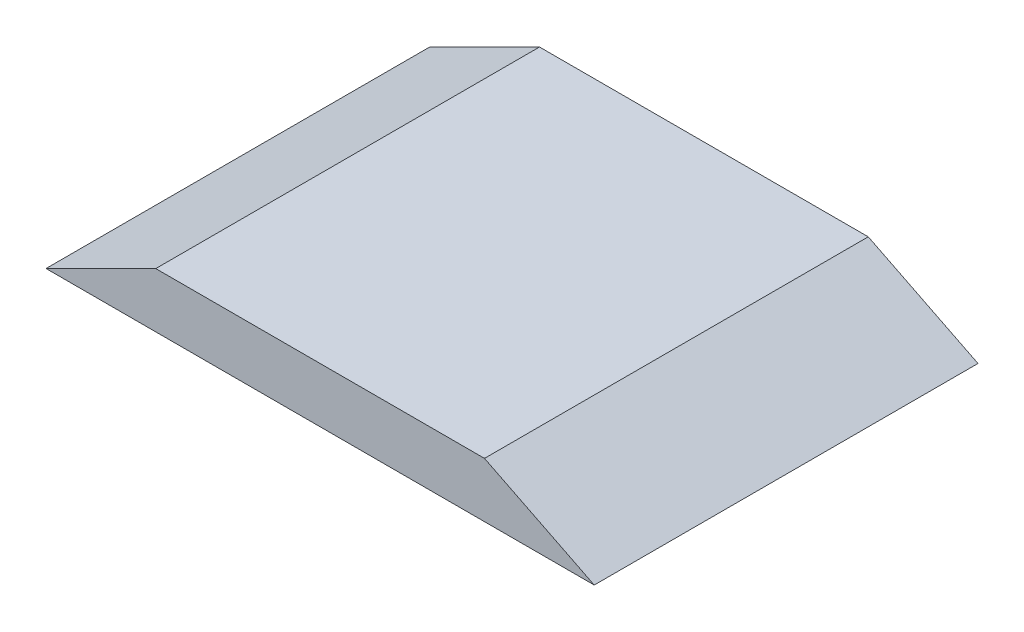
from build123d import *

# Parameters (mm, degrees)
BOSS_EXTRUDE1_DEPTH = 88.9


with BuildPart() as part:
    # Sketch1 → Boss-Extrude1 (new body)
    with BuildSketch(Plane.XY):
        Polygon((-63.5, -6.35), (-38.07671882, 6.35), (38.07671882, 6.35), (63.5, -6.35), align=None)
    extrude(amount=BOSS_EXTRUDE1_DEPTH)


solid = part.part
